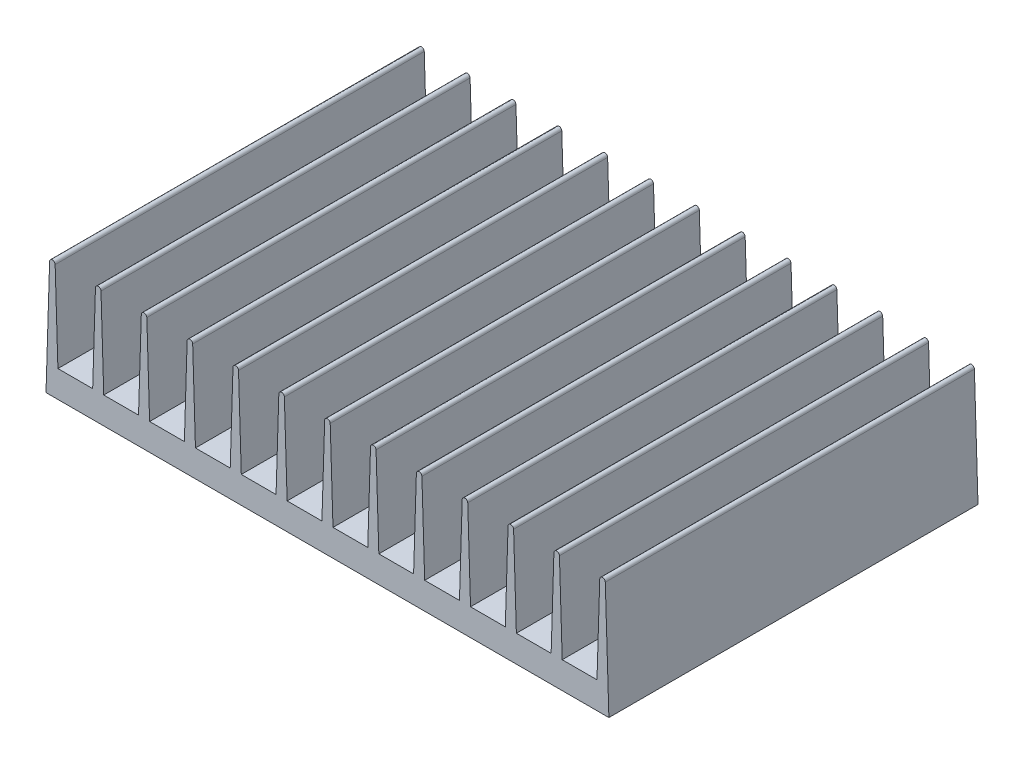
from build123d import *

# Parameters (mm, degrees)
BOSS_EXTRUDE1_DEPTH = 40


with BuildPart() as part:
    # Sketch1 → Boss-Extrude1 (new, symmetric)
    with BuildSketch(Plane.XY):
        with BuildLine():
            Line((-61, 0), (61, 0))
            Line((61, 0), (60.218926657, 25.018731725))
            ThreePointArc((60.218926657, 25.018731725), (59.618926657, 25.600292327), (59.018926657, 25.018731725))
            Line((59.018926657, 25.018731725), (58.418926657, 5.8))
            Line((58.418926657, 5.8), (50.882438881, 5.8))
            Line((50.882438881, 5.8), (50.282438881, 25.018731725))
            ThreePointArc((50.282438881, 25.018731725), (49.682438881, 25.600292327), (49.082438881, 25.018731725))
            Line((49.082438881, 25.018731725), (48.482438881, 5.8))
            Line((48.482438881, 5.8), (40.945951105, 5.8))
            Line((40.945951105, 5.8), (40.345951105, 25.018731725))
            ThreePointArc((40.345951105, 25.018731725), (39.745951105, 25.600292327), (39.145951105, 25.018731725))
            Line((39.145951105, 25.018731725), (38.545951105, 5.8))
            Line((38.545951105, 5.8), (31.009463329, 5.8))
            Line((31.009463329, 5.8), (30.409463329, 25.018731725))
            ThreePointArc((30.409463329, 25.018731725), (29.809463329, 25.600292327), (29.209463329, 25.018731725))
            Line((29.209463329, 25.018731725), (28.609463329, 5.8))
            Line((28.609463329, 5.8), (21.072975552, 5.8))
            Line((21.072975552, 5.8), (20.472975552, 25.018731725))
            ThreePointArc((20.472975552, 25.018731725), (19.872975552, 25.600292327), (19.272975552, 25.018731725))
            Line((19.272975552, 25.018731725), (18.672975552, 5.8))
            Line((18.672975552, 5.8), (11.136487776, 5.8))
            Line((11.136487776, 5.8), (10.536487776, 25.018731725))
            ThreePointArc((10.536487776, 25.018731725), (9.936487776, 25.600292327), (9.336487776, 25.018731725))
            Line((9.336487776, 25.018731725), (8.736487776, 5.8))
            Line((8.736487776, 5.8), (1.2, 5.8))
            Line((1.2, 5.8), (0.6, 25.018731725))
            ThreePointArc((0.6, 25.018731725), (0, 25.600292327), (-0.6, 25.018731725))
            Line((-0.6, 25.018731725), (-1.2, 5.8))
            Line((-1.2, 5.8), (-8.736487776, 5.8))
            Line((-8.736487776, 5.8), (-9.336487776, 25.018731725))
            ThreePointArc((-9.336487776, 25.018731725), (-9.936487776, 25.600292327), (-10.536487776, 25.018731725))
            Line((-10.536487776, 25.018731725), (-11.136487776, 5.8))
            Line((-11.136487776, 5.8), (-18.672975552, 5.8))
            Line((-18.672975552, 5.8), (-19.272975552, 25.018731725))
            ThreePointArc((-19.272975552, 25.018731725), (-19.872975552, 25.600292327), (-20.472975552, 25.018731725))
            Line((-20.472975552, 25.018731725), (-21.072975552, 5.8))
            Line((-21.072975552, 5.8), (-28.609463329, 5.8))
            Line((-28.609463329, 5.8), (-29.209463329, 25.018731725))
            ThreePointArc((-29.209463329, 25.018731725), (-29.809463329, 25.600292327), (-30.409463329, 25.018731725))
            Line((-30.409463329, 25.018731725), (-31.009463329, 5.8))
            Line((-31.009463329, 5.8), (-38.545951105, 5.8))
            Line((-38.545951105, 5.8), (-39.145951105, 25.018731725))
            ThreePointArc((-39.145951105, 25.018731725), (-39.745951105, 25.600292327), (-40.345951105, 25.018731725))
            Line((-40.345951105, 25.018731725), (-40.945951105, 5.8))
            Line((-40.945951105, 5.8), (-48.482438881, 5.8))
            Line((-48.482438881, 5.8), (-49.082438881, 25.018731725))
            ThreePointArc((-49.082438881, 25.018731725), (-49.682438881, 25.600292327), (-50.282438881, 25.018731725))
            Line((-50.282438881, 25.018731725), (-50.882438881, 5.8))
            Line((-50.882438881, 5.8), (-58.418926657, 5.8))
            Line((-58.418926657, 5.8), (-59.018926657, 25.018731725))
            ThreePointArc((-59.018926657, 25.018731725), (-59.618926657, 25.600292327), (-60.218926657, 25.018731725))
            Line((-60.218926657, 25.018731725), (-61, 0))
        make_face()
    extrude(amount=BOSS_EXTRUDE1_DEPTH, both=True)


solid = part.part
